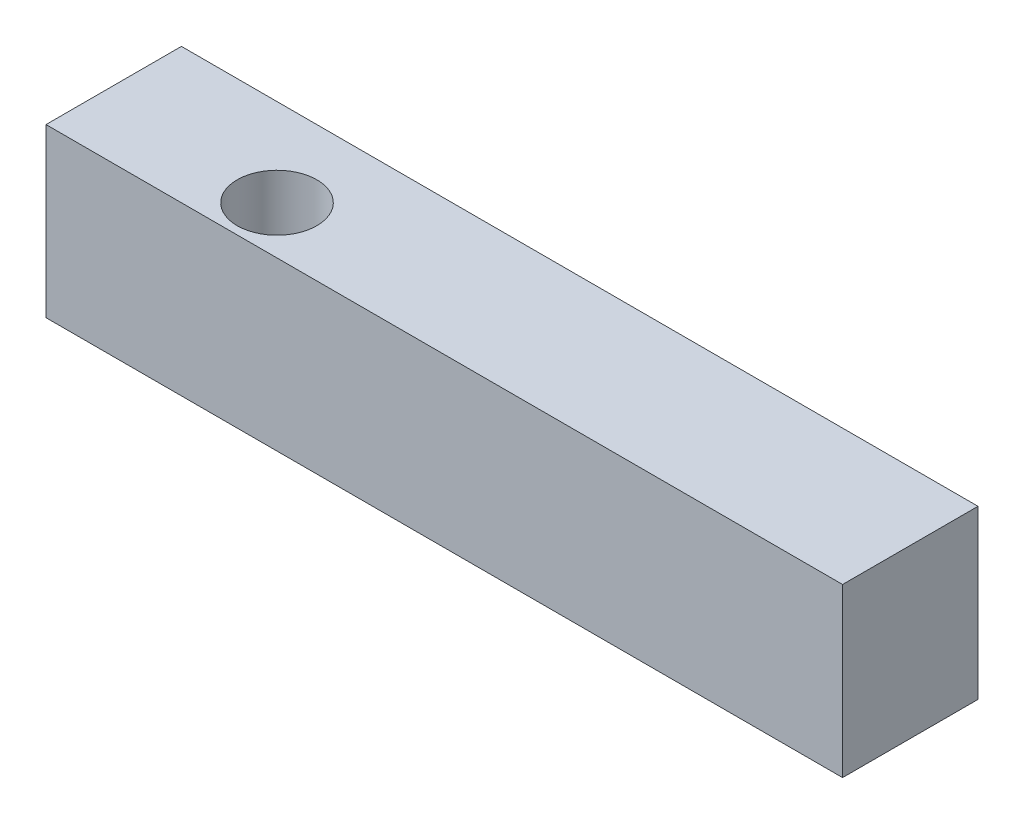
from build123d import *

# Parameters (mm, degrees)
SKETCH1_W           = 25.4
SKETCH1_H           = 5.334
BOSS_EXTRUDE1_DEPTH = 4.318
SKETCH2_R           = 1.27
CUT_EXTRUDE2_DEPTH  = 22.718057664


with BuildPart() as part:
    # Sketch1 → Boss-Extrude1 (new body)
    with BuildSketch(Plane.XY):
        with Locations((7.905274778, -0.284534644)):
            Rectangle(SKETCH1_W, SKETCH1_H)
    extrude(amount=BOSS_EXTRUDE1_DEPTH)

    # Sketch2 → Cut-Extrude2 (cut, through all)
    with BuildSketch(Plane(origin=(0, 2.382465356, 0), x_dir=(1, 0, 0), z_dir=(0, 1, 0))):
        with Locations((1.047274778, -2.794)):
            Circle(SKETCH2_R)
    extrude(amount=-CUT_EXTRUDE2_DEPTH, mode=Mode.SUBTRACT)


solid = part.part
